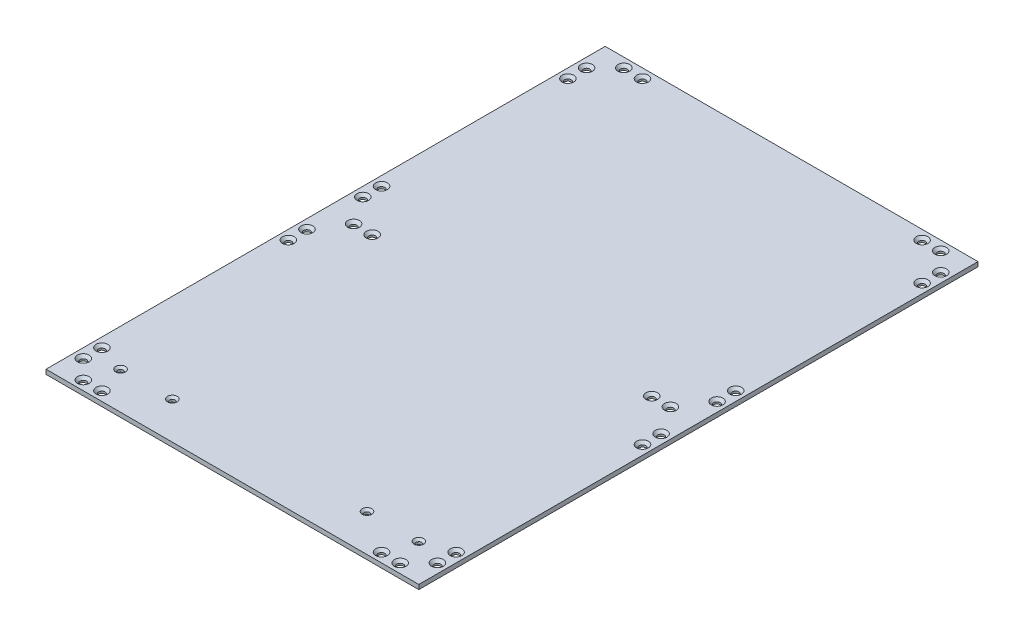
from build123d import *

# Parameters (mm, degrees)
SKETCH1_W                                      = 400
SKETCH1_H                                      = 600
BOSS_EXTRUDE1_DEPTH                            = 4.826
CSK_FOR_M6_FLAT_HEAD_MACHINE_SCREW4_AT_2_COUNT = 2
CSK_FOR_M6_FLAT_HEAD_MACHINE_SCREW4_AT_2_PITCH = 20
CSK_FOR_M6_FLAT_HEAD_MACHINE_SCREW4_AT_3_COUNT = 2
CSK_FOR_M6_FLAT_HEAD_MACHINE_SCREW4_AT_3_PITCH = 53.851648071
CSK_FOR_M6_FLAT_HEAD_MACHINE_SCREW4_AT_4_COUNT = 2
CSK_FOR_M6_FLAT_HEAD_MACHINE_SCREW4_AT_4_PITCH = 64.031242374
CSK_FOR_M6_FLAT_HEAD_MACHINE_SCREW4_AT_5_COUNT = 2
CSK_FOR_M6_FLAT_HEAD_MACHINE_SCREW4_AT_5_PITCH = 80
CSK_FOR_M6_FLAT_HEAD_MACHINE_SCREW4_AT_6_COUNT = 2
CSK_FOR_M6_FLAT_HEAD_MACHINE_SCREW4_AT_6_PITCH = 100
CSK_FOR_M6_FLAT_HEAD_MACHINE_SCREW4_AT_7_COUNT = 2
CSK_FOR_M6_FLAT_HEAD_MACHINE_SCREW4_AT_7_PITCH = 220
CSK_FOR_M6_FLAT_HEAD_MACHINE_SCREW4_AT_8_COUNT = 2
CSK_FOR_M6_FLAT_HEAD_MACHINE_SCREW4_AT_8_PITCH = 200
CSK_FOR_M6_FLAT_HEAD_MACHINE_SCREW4_AT_9_COUNT = 2
CSK_FOR_M6_FLAT_HEAD_MACHINE_SCREW4_AT_9_PITCH = 240.831891576
CSK_FOR_M6_FLAT_HEAD_MACHINE_SCREW4_AT_1_COUNT = 2
CSK_FOR_M6_FLAT_HEAD_MACHINE_SCREW4_AT_1_PITCH = 243.310501212
CSK_FOR_M6_FLAT_HEAD_MACHINE_SCREW4_2_COUNT    = 2
CSK_FOR_M6_FLAT_HEAD_MACHINE_SCREW4_2_PITCH    = 416.173040934
CSK_FOR_M6_FLAT_HEAD_MACHINE_SCREW4_3_COUNT    = 2
CSK_FOR_M6_FLAT_HEAD_MACHINE_SCREW4_3_PITCH    = 432.666153056
CSK_FOR_M6_FLAT_HEAD_MACHINE_SCREW4_4_COUNT    = 2
CSK_FOR_M6_FLAT_HEAD_MACHINE_SCREW4_4_PITCH    = 439.089968002
CSK_FOR_M6_FLAT_HEAD_MACHINE_SCREW4_5_COUNT    = 2
CSK_FOR_M6_FLAT_HEAD_MACHINE_SCREW4_5_PITCH    = 429.418211072
CSK_FOR_M6_FLAT_HEAD_MACHINE_SCREW4_6_COUNT    = 2
CSK_FOR_M6_FLAT_HEAD_MACHINE_SCREW4_6_PITCH    = 380.525951809
CSK_FOR_M6_FLAT_HEAD_MACHINE_SCREW4_7_COUNT    = 2
CSK_FOR_M6_FLAT_HEAD_MACHINE_SCREW4_7_PITCH    = 380
CSK_FOR_M6_FLAT_HEAD_MACHINE_SCREW4_8_COUNT    = 2
CSK_FOR_M6_FLAT_HEAD_MACHINE_SCREW4_8_PITCH    = 363.455636908
CSK_FOR_M6_FLAT_HEAD_MACHINE_SCREW4_9_COUNT    = 2
CSK_FOR_M6_FLAT_HEAD_MACHINE_SCREW4_9_PITCH    = 343.656805549
CSK_FOR_M6_FLAT_HEAD_MACHINE_SCREW4_10_COUNT   = 2
CSK_FOR_M6_FLAT_HEAD_MACHINE_SCREW4_10_PITCH   = 388.329756779
CSK_FOR_M6_FLAT_HEAD_MACHINE_SCREW4_11_COUNT   = 2
CSK_FOR_M6_FLAT_HEAD_MACHINE_SCREW4_11_PITCH   = 392.937654088
CSK_FOR_M6_FLAT_HEAD_MACHINE_SCREW4_12_COUNT   = 2
CSK_FOR_M6_FLAT_HEAD_MACHINE_SCREW4_12_PITCH   = 484.148737476
CSK_FOR_M6_FLAT_HEAD_MACHINE_SCREW4_13_COUNT   = 2
CSK_FOR_M6_FLAT_HEAD_MACHINE_SCREW4_13_PITCH   = 496.789693935
CSK_FOR_M6_FLAT_HEAD_MACHINE_SCREW4_14_COUNT   = 2
CSK_FOR_M6_FLAT_HEAD_MACHINE_SCREW4_14_PITCH   = 495.176736126
CSK_FOR_M6_FLAT_HEAD_MACHINE_SCREW4_15_COUNT   = 2
CSK_FOR_M6_FLAT_HEAD_MACHINE_SCREW4_15_PITCH   = 480.832611207
CSK_FOR_M6_FLAT_HEAD_MACHINE_SCREW4_16_COUNT   = 2
CSK_FOR_M6_FLAT_HEAD_MACHINE_SCREW4_16_PITCH   = 300
CSK_FOR_M6_FLAT_HEAD_MACHINE_SCREW4_17_COUNT   = 2
CSK_FOR_M6_FLAT_HEAD_MACHINE_SCREW4_17_PITCH   = 320
CSK_FOR_M6_FLAT_HEAD_MACHINE_SCREW4_18_COUNT   = 2
CSK_FOR_M6_FLAT_HEAD_MACHINE_SCREW4_18_PITCH   = 340.587727319
CSK_FOR_M6_FLAT_HEAD_MACHINE_SCREW4_19_COUNT   = 2
CSK_FOR_M6_FLAT_HEAD_MACHINE_SCREW4_19_PITCH   = 342.344855372
CSK_FOR_M5_FLAT_HEAD_MACHINE_SCREW1_AT_2_COUNT = 2
CSK_FOR_M5_FLAT_HEAD_MACHINE_SCREW1_AT_2_PITCH = 55.5625
CSK_FOR_M5_FLAT_HEAD_MACHINE_SCREW1_AT_3_COUNT = 2
CSK_FOR_M5_FLAT_HEAD_MACHINE_SCREW1_AT_3_PITCH = 264.4375
CSK_FOR_M5_FLAT_HEAD_MACHINE_SCREW1_AT_4_COUNT = 2
CSK_FOR_M5_FLAT_HEAD_MACHINE_SCREW1_AT_4_PITCH = 320


with BuildPart() as part:
    # Sketch1 → Boss-Extrude1 (new body)
    with BuildSketch(Plane(origin=(0, 0, 0), x_dir=(1, 0, 0), z_dir=(0, 1, 0))):
        with Locations((200, 300)):
            Rectangle(SKETCH1_W, SKETCH1_H)
    extrude(amount=BOSS_EXTRUDE1_DEPTH)

    # Sketch12 → CSK for M6 Flat Head Machine Screw4 (revolve, cut)
    with BuildSketch(Plane(origin=(10, 4.826, -250), x_dir=(0, 0, 1), z_dir=(1, 0, 0))):
        Polygon((0, 0), (0, 4.826), (3.5, 4.826), (3.5, 2.8), (6.3, 0), align=None)
    csk_for_m6_flat_head_machine_screw4 = revolve(axis=Axis((10, 11.176, -250), (0, -1, 0)), mode=Mode.SUBTRACT)

    # CSK for M6 Flat Head Machine Screw4 at 2: CSK for M6 Flat Head Machine Screw4 ×2
    with Locations(*[(0, 0, -i * CSK_FOR_M6_FLAT_HEAD_MACHINE_SCREW4_AT_2_PITCH) for i in range(1, CSK_FOR_M6_FLAT_HEAD_MACHINE_SCREW4_AT_2_COUNT)]):
        add(csk_for_m6_flat_head_machine_screw4, mode=Mode.SUBTRACT)

    # CSK for M6 Flat Head Machine Screw4 at 3: CSK for M6 Flat Head Machine Screw4 ×2
    with Locations(*[Vector(0.3713906763541037, 0, -0.9284766908852593) * (i * CSK_FOR_M6_FLAT_HEAD_MACHINE_SCREW4_AT_3_PITCH) for i in range(1, CSK_FOR_M6_FLAT_HEAD_MACHINE_SCREW4_AT_3_COUNT)]):
        add(csk_for_m6_flat_head_machine_screw4, mode=Mode.SUBTRACT)

    # CSK for M6 Flat Head Machine Screw4 at 4: CSK for M6 Flat Head Machine Screw4 ×2
    with Locations(*[Vector(0.6246950475544243, 0, -0.7808688094430304) * (i * CSK_FOR_M6_FLAT_HEAD_MACHINE_SCREW4_AT_4_PITCH) for i in range(1, CSK_FOR_M6_FLAT_HEAD_MACHINE_SCREW4_AT_4_COUNT)]):
        add(csk_for_m6_flat_head_machine_screw4, mode=Mode.SUBTRACT)

    # CSK for M6 Flat Head Machine Screw4 at 5: CSK for M6 Flat Head Machine Screw4 ×2
    with Locations(*[(0, 0, -i * CSK_FOR_M6_FLAT_HEAD_MACHINE_SCREW4_AT_5_PITCH) for i in range(1, CSK_FOR_M6_FLAT_HEAD_MACHINE_SCREW4_AT_5_COUNT)]):
        add(csk_for_m6_flat_head_machine_screw4, mode=Mode.SUBTRACT)

    # CSK for M6 Flat Head Machine Screw4 at 6: CSK for M6 Flat Head Machine Screw4 ×2
    with Locations(*[(0, 0, -i * CSK_FOR_M6_FLAT_HEAD_MACHINE_SCREW4_AT_6_PITCH) for i in range(1, CSK_FOR_M6_FLAT_HEAD_MACHINE_SCREW4_AT_6_COUNT)]):
        add(csk_for_m6_flat_head_machine_screw4, mode=Mode.SUBTRACT)

    # CSK for M6 Flat Head Machine Screw4 at 7: CSK for M6 Flat Head Machine Screw4 ×2
    with Locations(*[(0, 0, i * CSK_FOR_M6_FLAT_HEAD_MACHINE_SCREW4_AT_7_PITCH) for i in range(1, CSK_FOR_M6_FLAT_HEAD_MACHINE_SCREW4_AT_7_COUNT)]):
        add(csk_for_m6_flat_head_machine_screw4, mode=Mode.SUBTRACT)

    # CSK for M6 Flat Head Machine Screw4 at 8: CSK for M6 Flat Head Machine Screw4 ×2
    with Locations(*[(0, 0, i * CSK_FOR_M6_FLAT_HEAD_MACHINE_SCREW4_AT_8_PITCH) for i in range(1, CSK_FOR_M6_FLAT_HEAD_MACHINE_SCREW4_AT_8_COUNT)]):
        add(csk_for_m6_flat_head_machine_screw4, mode=Mode.SUBTRACT)

    # CSK for M6 Flat Head Machine Screw4 at 9: CSK for M6 Flat Head Machine Screw4 ×2
    with Locations(*[Vector(0.08304547985373999, 0, 0.9965457582448797) * (i * CSK_FOR_M6_FLAT_HEAD_MACHINE_SCREW4_AT_9_PITCH) for i in range(1, CSK_FOR_M6_FLAT_HEAD_MACHINE_SCREW4_AT_9_COUNT)]):
        add(csk_for_m6_flat_head_machine_screw4, mode=Mode.SUBTRACT)

    # CSK for M6 Flat Head Machine Screw4 at 1: CSK for M6 Flat Head Machine Screw4 ×2
    with Locations(*[Vector(0.1643989873053573, 0, 0.9863939238321437) * (i * CSK_FOR_M6_FLAT_HEAD_MACHINE_SCREW4_AT_1_PITCH) for i in range(1, CSK_FOR_M6_FLAT_HEAD_MACHINE_SCREW4_AT_1_COUNT)]):
        add(csk_for_m6_flat_head_machine_screw4, mode=Mode.SUBTRACT)

    # CSK for M6 Flat Head Machine Screw4  2: CSK for M6 Flat Head Machine Screw4 ×2
    with Locations(*[Vector(0.8169678632647618, 0, 0.5766831975986553) * (i * CSK_FOR_M6_FLAT_HEAD_MACHINE_SCREW4_2_PITCH) for i in range(1, CSK_FOR_M6_FLAT_HEAD_MACHINE_SCREW4_2_COUNT)]):
        add(csk_for_m6_flat_head_machine_screw4, mode=Mode.SUBTRACT)

    # CSK for M6 Flat Head Machine Screw4  3: CSK for M6 Flat Head Machine Screw4 ×2
    with Locations(*[Vector(0.8320502943378437, 0, 0.554700196225229) * (i * CSK_FOR_M6_FLAT_HEAD_MACHINE_SCREW4_3_PITCH) for i in range(1, CSK_FOR_M6_FLAT_HEAD_MACHINE_SCREW4_3_COUNT)]):
        add(csk_for_m6_flat_head_machine_screw4, mode=Mode.SUBTRACT)

    # CSK for M6 Flat Head Machine Screw4  4: CSK for M6 Flat Head Machine Screw4 ×2
    with Locations(*[Vector(0.8654262854811262, 0, 0.5010362705417046) * (i * CSK_FOR_M6_FLAT_HEAD_MACHINE_SCREW4_4_PITCH) for i in range(1, CSK_FOR_M6_FLAT_HEAD_MACHINE_SCREW4_4_COUNT)]):
        add(csk_for_m6_flat_head_machine_screw4, mode=Mode.SUBTRACT)

    # CSK for M6 Flat Head Machine Screw4  5: CSK for M6 Flat Head Machine Screw4 ×2
    with Locations(*[Vector(0.8849182223819824, 0, 0.4657464328326223) * (i * CSK_FOR_M6_FLAT_HEAD_MACHINE_SCREW4_5_PITCH) for i in range(1, CSK_FOR_M6_FLAT_HEAD_MACHINE_SCREW4_5_COUNT)]):
        add(csk_for_m6_flat_head_machine_screw4, mode=Mode.SUBTRACT)

    # CSK for M6 Flat Head Machine Screw4  6: CSK for M6 Flat Head Machine Screw4 ×2
    with Locations(*[Vector(0.9986178293325098, 0, -0.052558833122763673) * (i * CSK_FOR_M6_FLAT_HEAD_MACHINE_SCREW4_6_PITCH) for i in range(1, CSK_FOR_M6_FLAT_HEAD_MACHINE_SCREW4_6_COUNT)]):
        add(csk_for_m6_flat_head_machine_screw4, mode=Mode.SUBTRACT)

    # CSK for M6 Flat Head Machine Screw4  7: CSK for M6 Flat Head Machine Screw4 ×2
    with Locations(*[(i * CSK_FOR_M6_FLAT_HEAD_MACHINE_SCREW4_7_PITCH, 0, 0) for i in range(1, CSK_FOR_M6_FLAT_HEAD_MACHINE_SCREW4_7_COUNT)]):
        add(csk_for_m6_flat_head_machine_screw4, mode=Mode.SUBTRACT)

    # CSK for M6 Flat Head Machine Screw4  8: CSK for M6 Flat Head Machine Screw4 ×2
    with Locations(*[Vector(0.9904922731777516, 0, -0.1375683712746877) * (i * CSK_FOR_M6_FLAT_HEAD_MACHINE_SCREW4_8_PITCH) for i in range(1, CSK_FOR_M6_FLAT_HEAD_MACHINE_SCREW4_8_COUNT)]):
        add(csk_for_m6_flat_head_machine_screw4, mode=Mode.SUBTRACT)

    # CSK for M6 Flat Head Machine Screw4  9: CSK for M6 Flat Head Machine Screw4 ×2
    with Locations(*[Vector(0.9893591353648532, 0, -0.14549399049483136) * (i * CSK_FOR_M6_FLAT_HEAD_MACHINE_SCREW4_9_PITCH) for i in range(1, CSK_FOR_M6_FLAT_HEAD_MACHINE_SCREW4_9_COUNT)]):
        add(csk_for_m6_flat_head_machine_screw4, mode=Mode.SUBTRACT)

    # CSK for M6 Flat Head Machine Screw4  10: CSK for M6 Flat Head Machine Screw4 ×2
    with Locations(*[Vector(0.978549784986749, 0, -0.20601048104984176) * (i * CSK_FOR_M6_FLAT_HEAD_MACHINE_SCREW4_10_PITCH) for i in range(1, CSK_FOR_M6_FLAT_HEAD_MACHINE_SCREW4_10_COUNT)]):
        add(csk_for_m6_flat_head_machine_screw4, mode=Mode.SUBTRACT)

    # CSK for M6 Flat Head Machine Screw4  11: CSK for M6 Flat Head Machine Screw4 ×2
    with Locations(*[Vector(0.9670745372626465, 0, -0.2544932992796438) * (i * CSK_FOR_M6_FLAT_HEAD_MACHINE_SCREW4_11_PITCH) for i in range(1, CSK_FOR_M6_FLAT_HEAD_MACHINE_SCREW4_11_COUNT)]):
        add(csk_for_m6_flat_head_machine_screw4, mode=Mode.SUBTRACT)

    # CSK for M6 Flat Head Machine Screw4  12: CSK for M6 Flat Head Machine Screw4 ×2
    with Locations(*[Vector(0.7848827655334263, 0, -0.6196442885790208) * (i * CSK_FOR_M6_FLAT_HEAD_MACHINE_SCREW4_12_PITCH) for i in range(1, CSK_FOR_M6_FLAT_HEAD_MACHINE_SCREW4_12_COUNT)]):
        add(csk_for_m6_flat_head_machine_screw4, mode=Mode.SUBTRACT)

    # CSK for M6 Flat Head Machine Screw4  13: CSK for M6 Flat Head Machine Screw4 ×2
    with Locations(*[Vector(0.7649111981170508, 0, -0.6441357457827798) * (i * CSK_FOR_M6_FLAT_HEAD_MACHINE_SCREW4_13_PITCH) for i in range(1, CSK_FOR_M6_FLAT_HEAD_MACHINE_SCREW4_13_COUNT)]):
        add(csk_for_m6_flat_head_machine_screw4, mode=Mode.SUBTRACT)

    # CSK for M6 Flat Head Machine Screw4  14: CSK for M6 Flat Head Machine Screw4 ×2
    with Locations(*[Vector(0.7270131525498175, 0, -0.6866235329637165) * (i * CSK_FOR_M6_FLAT_HEAD_MACHINE_SCREW4_14_PITCH) for i in range(1, CSK_FOR_M6_FLAT_HEAD_MACHINE_SCREW4_14_COUNT)]):
        add(csk_for_m6_flat_head_machine_screw4, mode=Mode.SUBTRACT)

    # CSK for M6 Flat Head Machine Screw4  15: CSK for M6 Flat Head Machine Screw4 ×2
    with Locations(*[Vector(0.7071067811865476, 0, -0.7071067811865475) * (i * CSK_FOR_M6_FLAT_HEAD_MACHINE_SCREW4_15_PITCH) for i in range(1, CSK_FOR_M6_FLAT_HEAD_MACHINE_SCREW4_15_COUNT)]):
        add(csk_for_m6_flat_head_machine_screw4, mode=Mode.SUBTRACT)

    # CSK for M6 Flat Head Machine Screw4  16: CSK for M6 Flat Head Machine Screw4 ×2
    with Locations(*[(0, 0, -i * CSK_FOR_M6_FLAT_HEAD_MACHINE_SCREW4_16_PITCH) for i in range(1, CSK_FOR_M6_FLAT_HEAD_MACHINE_SCREW4_16_COUNT)]):
        add(csk_for_m6_flat_head_machine_screw4, mode=Mode.SUBTRACT)

    # CSK for M6 Flat Head Machine Screw4  17: CSK for M6 Flat Head Machine Screw4 ×2
    with Locations(*[(0, 0, -i * CSK_FOR_M6_FLAT_HEAD_MACHINE_SCREW4_17_PITCH) for i in range(1, CSK_FOR_M6_FLAT_HEAD_MACHINE_SCREW4_17_COUNT)]):
        add(csk_for_m6_flat_head_machine_screw4, mode=Mode.SUBTRACT)

    # CSK for M6 Flat Head Machine Screw4  18: CSK for M6 Flat Head Machine Screw4 ×2
    with Locations(*[Vector(0.05872202195147036, 0, -0.9982743731749959) * (i * CSK_FOR_M6_FLAT_HEAD_MACHINE_SCREW4_18_PITCH) for i in range(1, CSK_FOR_M6_FLAT_HEAD_MACHINE_SCREW4_18_COUNT)]):
        add(csk_for_m6_flat_head_machine_screw4, mode=Mode.SUBTRACT)

    # CSK for M6 Flat Head Machine Screw4  19: CSK for M6 Flat Head Machine Screw4 ×2
    with Locations(*[Vector(0.11684124756739721, 0, -0.9931506043228763) * (i * CSK_FOR_M6_FLAT_HEAD_MACHINE_SCREW4_19_PITCH) for i in range(1, CSK_FOR_M6_FLAT_HEAD_MACHINE_SCREW4_19_COUNT)]):
        add(csk_for_m6_flat_head_machine_screw4, mode=Mode.SUBTRACT)

    # Sketch16 → CSK for M5 Flat Head Machine Screw1 (revolve, cut)
    with BuildSketch(Plane(origin=(40, 4.826, -40), x_dir=(0, 0, 1), z_dir=(1, 0, 0))):
        Polygon((0, 0), (0, 4.826), (2.9, 4.826), (2.9, 2.3), (5.2, 0), align=None)
    csk_for_m5_flat_head_machine_screw1 = revolve(axis=Axis((40, 11.176, -40), (0, -1, 0)), mode=Mode.SUBTRACT)

    # CSK for M5 Flat Head Machine Screw1 at 2: CSK for M5 Flat Head Machine Screw1 ×2
    with Locations(*[(i * CSK_FOR_M5_FLAT_HEAD_MACHINE_SCREW1_AT_2_PITCH, 0, 0) for i in range(1, CSK_FOR_M5_FLAT_HEAD_MACHINE_SCREW1_AT_2_COUNT)]):
        add(csk_for_m5_flat_head_machine_screw1, mode=Mode.SUBTRACT)

    # CSK for M5 Flat Head Machine Screw1 at 3: CSK for M5 Flat Head Machine Screw1 ×2
    with Locations(*[(i * CSK_FOR_M5_FLAT_HEAD_MACHINE_SCREW1_AT_3_PITCH, 0, 0) for i in range(1, CSK_FOR_M5_FLAT_HEAD_MACHINE_SCREW1_AT_3_COUNT)]):
        add(csk_for_m5_flat_head_machine_screw1, mode=Mode.SUBTRACT)

    # CSK for M5 Flat Head Machine Screw1 at 4: CSK for M5 Flat Head Machine Screw1 ×2
    with Locations(*[(i * CSK_FOR_M5_FLAT_HEAD_MACHINE_SCREW1_AT_4_PITCH, 0, 0) for i in range(1, CSK_FOR_M5_FLAT_HEAD_MACHINE_SCREW1_AT_4_COUNT)]):
        add(csk_for_m5_flat_head_machine_screw1, mode=Mode.SUBTRACT)


solid = part.part
